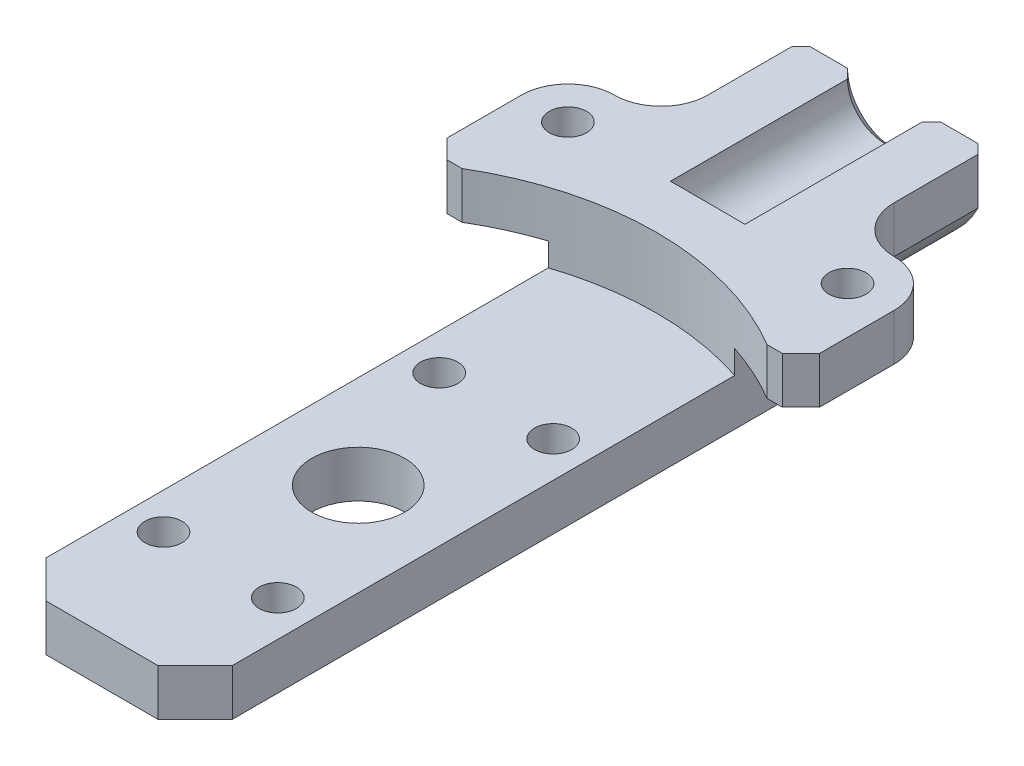
from build123d import *

# Parameters (mm, degrees)
SKETCH4_W           = 20
SKETCH4_H           = 85
BOSS_EXTRUDE6_DEPTH = 5
SKETCH5_W           = 20
SKETCH5_H           = 30
BOSS_EXTRUDE7_DEPTH = 7.5
SKETCH6_R           = 4
CUT_EXTRUDE1_DEPTH  = 20
SKETCH7_W           = 15
SKETCH7_H           = 5
BOSS_EXTRUDE8_DEPTH = 10
FILLET2_START       = 7.5
FILLET2_DEPTH       = 5
FILLET2_2_DEPTH     = 5
SKETCH8_R           = 2
CUT_EXTRUDE2_DEPTH  = 48.565743976
CUT_EXTRUDE4_DEPTH  = 15
CHAMFER4_SIZE       = 5
CHAMFER7_SIZE       = 1
CHAMFER8_SIZE       = 1
SKETCH10_R          = 2
SKETCH10_R_2        = 5
CUT_EXTRUDE5_DEPTH  = 49.605555238
CHAMFER9_SIZE       = 4
CUT_EXTRUDE6_REACH  = 50.606
SKETCH11_R          = 32
CHAMFER10_SIZE      = 2


with BuildPart() as part:
    # Sketch4 → Boss-Extrude6 (new body)
    with BuildSketch(Plane(origin=(0, 0, 0), x_dir=(1, 0, 0), z_dir=(0, 1, 0))):
        Rectangle(SKETCH4_W, SKETCH4_H)
    extrude(amount=BOSS_EXTRUDE6_DEPTH)

    # Sketch5 → Boss-Extrude7 (add)
    with BuildSketch(Plane(origin=(0, 5, 0), x_dir=(1, 0, 0), z_dir=(0, 1, 0))):
        with Locations((0, 27.5)):
            Rectangle(SKETCH5_W, SKETCH5_H)
    extrude(amount=BOSS_EXTRUDE7_DEPTH)

    # Sketch6 → Cut-Extrude1 (cut)
    with BuildSketch(Plane(origin=(0, 0, -42.5), x_dir=(-1, 0, 0), z_dir=(0, 0, -1))):
        with Locations((0, 12.5)):
            Circle(SKETCH6_R)
    extrude(amount=-CUT_EXTRUDE1_DEPTH, mode=Mode.SUBTRACT)

    # Sketch7 → Boss-Extrude8 (add)
    with BuildSketch(Plane.ZY.offset(10)):
        with Locations((-20, 10)):
            Rectangle(SKETCH7_W, SKETCH7_H)
    boss_extrude8 = extrude(amount=BOSS_EXTRUDE8_DEPTH)

    # Mirror1: Boss-Extrude8 across plane
    add(boss_extrude8.mirror(Plane(origin=(0, 0, 0), x_dir=(0, 0, 1), z_dir=(1, 0, 0))))

    # Fillet2: read off the stored shape, not the designer's step
    # Fillet2 outline → Fillet2 (cut)
    with BuildSketch(Plane(origin=(0, 0, 0), x_dir=(1, 0, 0), z_dir=(0, 1, 0)).offset(FILLET2_START)):
        with BuildLine():
            ThreePointArc((15, 27.5), (18.535533906, 26.035533906), (20, 22.5))
            Line((20, 22.5), (20, 27.5))
            Line((20, 27.5), (15, 27.5))
        make_face()
        with BuildLine():
            ThreePointArc((-20, 22.5), (-18.535533906, 26.035533906), (-15, 27.5))
            Line((-15, 27.5), (-20, 27.5))
            Line((-20, 27.5), (-20, 22.5))
        make_face()
    extrude(amount=FILLET2_DEPTH, mode=Mode.SUBTRACT)

    # Fillet2 2 outline → Fillet2 2 (add)
    with BuildSketch(Plane(origin=(0, 0, 0), x_dir=(1, 0, 0), z_dir=(0, 1, 0)).offset(FILLET2_START)):
        with BuildLine():
            Line((10, 27.5), (15, 27.5))
            ThreePointArc((15, 27.5), (11.464466094, 28.964466094), (10, 32.5))
            Line((10, 32.5), (10, 27.5))
        make_face()
        with BuildLine():
            ThreePointArc((-10, 32.5), (-11.464466094, 28.964466094), (-15, 27.5))
            Line((-15, 27.5), (-10, 27.5))
            Line((-10, 27.5), (-10, 32.5))
        make_face()
    extrude(amount=FILLET2_2_DEPTH)

    # Sketch8 → Cut-Extrude2 (cut, through all)
    with BuildSketch(Plane.XZ.offset(-7.5)):
        with Locations(Location((-15, -22.5, 0), (0, 0, 270))):
            Circle(SKETCH8_R)
        with Locations(Location((15, -22.5, 0), (0, 0, 270))):
            Circle(SKETCH8_R)
    extrude(amount=-CUT_EXTRUDE2_DEPTH, mode=Mode.SUBTRACT)

    # Sketch9 → Cut-Extrude4 (cut)
    with BuildSketch(Plane(origin=(0, 0, -42.5), x_dir=(-1, 0, 0), z_dir=(0, 0, -1))):
        with BuildLine():
            Line((-10, 7.5), (-10, 0))
            Line((-10, 0), (10, 0))
            Line((10, 0), (10, 7.5))
            ThreePointArc((10, 7.5), (0, 1.319660113), (-10, 7.5))
        make_face()
    extrude(amount=-CUT_EXTRUDE4_DEPTH, mode=Mode.SUBTRACT)

    # Chamfer4
    # the kernel refuses this chamfer: 5 mm, written as the material it adds along each edge
    with BuildSketch(Plane(origin=(0, 12.5, -27.5), x_dir=(-0.7729223177191435, 0.6345006625462793, 0), z_dir=(0.6345006625462793, 0.7729223177191435, 0))) as chamfer4_piece_1_section:
        Polygon((11.180339887 + CHAMFER4_SIZE, 0), (11.180339887, -CHAMFER4_SIZE), (11.180339887, 0), align=None)
    chamfer4_piece_1 = revolve(axis=Axis((0, 12.5, -27.5), (0, 0, 1)), revolution_arc=258.765918747, mode=Mode.PRIVATE)
    chamfer4_piece_1 = split(chamfer4_piece_1, bisect_by=Plane(origin=(-10, 12.5, -27.5), z_dir=(1, 0, 0)), keep=Keep.TOP, mode=Mode.PRIVATE)
    chamfer4_piece_1 = split(chamfer4_piece_1, bisect_by=Plane(origin=(10, 12.5, -27.5), z_dir=(-1, 0, 0)), keep=Keep.TOP, mode=Mode.PRIVATE)
    chamfer4_piece_1 = split(chamfer4_piece_1, bisect_by=Plane(origin=(0, 0, -27.5), z_dir=(0, 1, 0)), keep=Keep.TOP, mode=Mode.PRIVATE)
    chamfer4_piece_1 = split(chamfer4_piece_1, bisect_by=Plane(origin=(0, 12.5, -27.5), z_dir=(0, -1, 0)), keep=Keep.TOP, mode=Mode.PRIVATE)
    add(chamfer4_piece_1)

    # Chamfer7
    chamfer7_edges = [part.edges().sort_by_distance(p)[0] for p in [
        (0, 8.5, -42.5),
    ]]
    chamfer(chamfer7_edges, length=CHAMFER7_SIZE)

    # Chamfer8
    chamfer8_edges = [part.edges().sort_by_distance(p)[0] for p in [
        (0, 1.319660113, -42.5),
        (-10, 10, -42.5),
        (10, 10, -42.5),
    ]]
    chamfer(chamfer8_edges, length=CHAMFER8_SIZE)

    # Sketch10 → Cut-Extrude5 (cut, through all)
    with BuildSketch(Plane.XZ):
        with Locations(Location((-6.1024, 0.209438339, 0), (0, 0, 270))):
            Circle(SKETCH10_R)
        with Locations(Location((6.143458026, 0.226445131, 0), (0, 0, 270))):
            Circle(SKETCH10_R)
        with Locations(Location((6.143458026, 29.773554869, 0), (0, 0, 270))):
            Circle(SKETCH10_R)
        with Locations(Location((-6.1024, 29.790561661, 0), (0, 0, 270))):
            Circle(SKETCH10_R)
        with Locations(Location((0, 15, 0), (0, 0, 270))):
            Circle(SKETCH10_R_2)
    extrude(amount=-CUT_EXTRUDE5_DEPTH, mode=Mode.SUBTRACT)

    # Chamfer9
    chamfer9_edges = [part.edges().sort_by_distance(p)[0] for p in [
        (10, 2.5, 42.5),
        (-10, 2.5, 42.5),
    ]]
    chamfer(chamfer9_edges, length=CHAMFER9_SIZE)

    # Cut-Extrude6: up to this face of the body (flat: up to its plane)
    cut_extrude6_end = Plane(part.part.faces().sort_by_distance((-9.414765004, 5, 13))[0])
    # Sketch11 → Cut-Extrude6 (cut, up to the picked face)
    with BuildSketch(Plane(origin=(0, 12.5, 0), x_dir=(1, 0, 0), z_dir=(0, 1, 0)), mode=Mode.PRIVATE) as cut_extrude6_sk1:
        with Locations((0, -15)):
            Circle(SKETCH11_R)
    cut_extrude6_tool1 = split(extrude(cut_extrude6_sk1.sketch, amount=-CUT_EXTRUDE6_REACH, mode=Mode.PRIVATE), bisect_by=cut_extrude6_end, keep=Keep.BOTH, mode=Mode.PRIVATE)
    add(cut_extrude6_tool1.solids().sort_by(Axis((0, 12.5, 15), (0, -1, 0)))[0], mode=Mode.SUBTRACT)

    # Chamfer10
    chamfer10_edges = [part.edges().sort_by_distance(p)[0] for p in [
        (-20, 10, -12.5),
        (20, 10, -12.5),
    ]]
    chamfer(chamfer10_edges, length=CHAMFER10_SIZE)


solid = part.part
